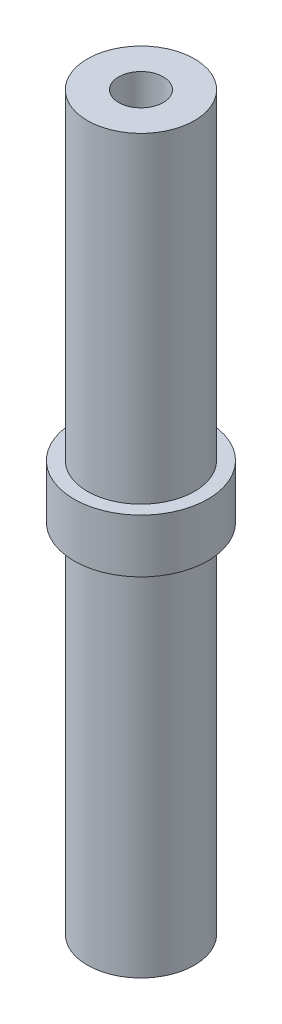
from build123d import *

# Parameters (mm, degrees)
BOSS_EXTRUDE1_DEPTH      = 20.5
BOSS_EXTRUDE1_DEPTH_BACK = 20.5
SKETCH1_R                = 3
SKETCH6_R                = 3.75
BOSS_EXTRUDE2_DEPTH      = 3


with BuildPart() as part:
    # Sketch1 → Boss-Extrude1 (new, two sides: drawn at the far end of the back side and taken through both)
    with BuildSketch(Plane(origin=(0, 0, 0), x_dir=(1, 0, 0), z_dir=(0, 1, 0)).offset(-BOSS_EXTRUDE1_DEPTH_BACK)):
        Circle(SKETCH1_R)
    extrude(amount=BOSS_EXTRUDE1_DEPTH + BOSS_EXTRUDE1_DEPTH_BACK)

    # Sketch5 → M3x0.5 Tapped Hole1 (revolve, cut)
    with BuildSketch(Plane(origin=(0, 20.5, 0), x_dir=(0, 0, 1), z_dir=(1, 0, 0))):
        Polygon((0, 0), (0, 8.751075774), (1.25, 8), (1.25, 0), align=None)
    m3x0_5_tapped_hole1 = revolve(axis=Axis((0, 26.85, 0), (0, -1, 0)), mode=Mode.SUBTRACT)

    # Sketch6 → Boss-Extrude2 (add)
    with BuildSketch(Plane(origin=(0, -0.5, 0), x_dir=(1, 0, 0), z_dir=(0, 1, 0))):
        Circle(SKETCH6_R)
    extrude(amount=BOSS_EXTRUDE2_DEPTH)

    # Mirror1: M3x0.5 Tapped Hole1 across plane
    add(m3x0_5_tapped_hole1.mirror(Plane.ZX), mode=Mode.SUBTRACT)


solid = part.part
